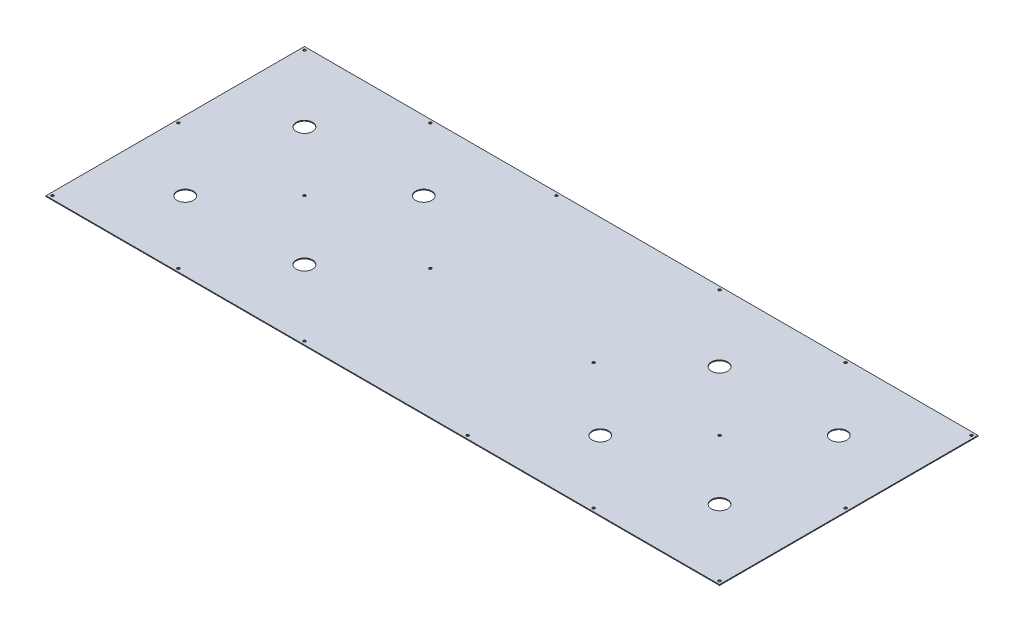
from build123d import *

# Parameters (mm, degrees)
MAIN_PLATE_W        = 834
MAIN_PLATE_H        = 320
BOSS_EXTRUDE1_DEPTH = 1.016
MAIN_HOLES_R        = 1.6
CUT_EXTRUDE1_DEPTH  = 447.64307031
SMA_R               = 10
CUT_EXTRUDE2_DEPTH  = 447.64307031


with BuildPart() as part:
    # main_plate → Boss-Extrude1 (new body)
    with BuildSketch(Plane(origin=(0, 0, 0), x_dir=(1, 0, 0), z_dir=(0, 1, 0))):
        Rectangle(MAIN_PLATE_W, MAIN_PLATE_H)
    extrude(amount=BOSS_EXTRUDE1_DEPTH)

    # main_holes → Cut-Extrude1 (cut, through all)
    with BuildSketch(Plane(origin=(0, 1.016, 0), x_dir=(1, 0, 0), z_dir=(0, 1, 0))):
        with Locations((-413, 156)):
            Circle(MAIN_HOLES_R)
        with Locations((-257, 156)):
            Circle(MAIN_HOLES_R)
        with Locations((-101, 156)):
            Circle(MAIN_HOLES_R)
        with Locations((-257, 0)):
            Circle(MAIN_HOLES_R)
        with Locations((-101, 0)):
            Circle(MAIN_HOLES_R)
        with Locations((-257, -156)):
            Circle(MAIN_HOLES_R)
        with Locations((-101, -156)):
            Circle(MAIN_HOLES_R)
        with Locations((-413, 0)):
            Circle(MAIN_HOLES_R)
        with Locations((-413, -156)):
            Circle(MAIN_HOLES_R)
        with Locations((413, -156)):
            Circle(MAIN_HOLES_R)
        with Locations((413, 0)):
            Circle(MAIN_HOLES_R)
        with Locations((101, -156)):
            Circle(MAIN_HOLES_R)
        with Locations((257, -156)):
            Circle(MAIN_HOLES_R)
        with Locations((101, 0)):
            Circle(MAIN_HOLES_R)
        with Locations((257, 0)):
            Circle(MAIN_HOLES_R)
        with Locations((101, 156)):
            Circle(MAIN_HOLES_R)
        with Locations((257, 156)):
            Circle(MAIN_HOLES_R)
        with Locations((413, 156)):
            Circle(MAIN_HOLES_R)
    extrude(amount=-CUT_EXTRUDE1_DEPTH, mode=Mode.SUBTRACT)

    # sma → Cut-Extrude2 (cut, through all)
    with BuildSketch(Plane(origin=(0, 1.016, 0), x_dir=(1, 0, 0), z_dir=(0, 1, 0))):
        with Locations((-330.81875, 73.81875)):
            Circle(SMA_R)
        with Locations((-183.18125, 73.81875)):
            Circle(SMA_R)
        with Locations((-183.18125, -73.81875)):
            Circle(SMA_R)
        with Locations((-330.81875, -73.81875)):
            Circle(SMA_R)
        with Locations((330.81875, -73.81875)):
            Circle(SMA_R)
        with Locations((183.18125, -73.81875)):
            Circle(SMA_R)
        with Locations((183.18125, 73.81875)):
            Circle(SMA_R)
        with Locations((330.81875, 73.81875)):
            Circle(SMA_R)
    extrude(amount=-CUT_EXTRUDE2_DEPTH, mode=Mode.SUBTRACT)


solid = part.part
